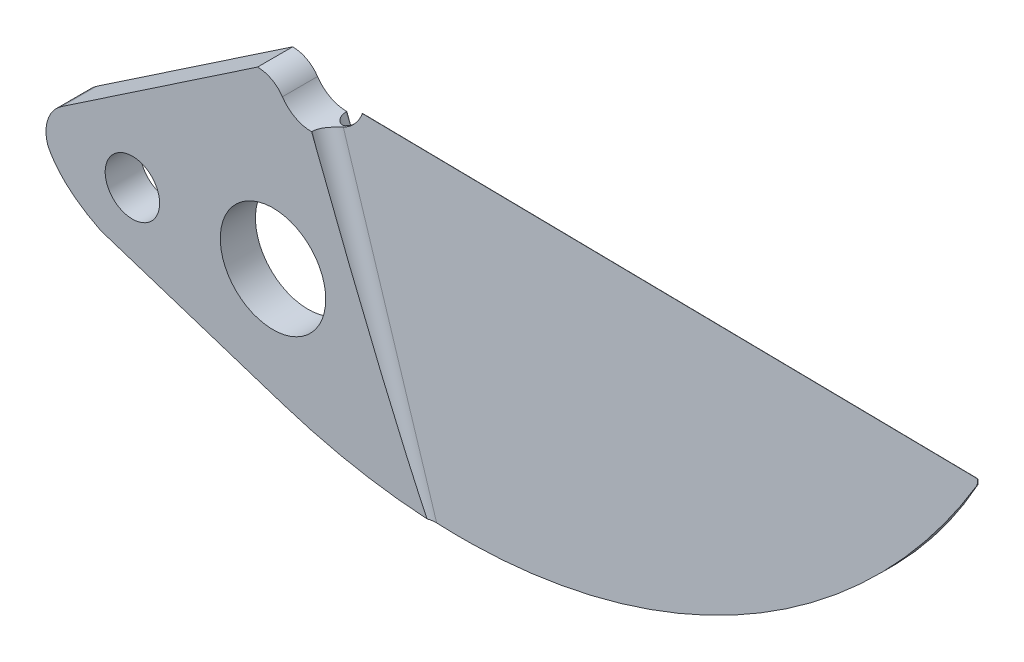
from build123d import *

# Parameters (mm, degrees)
SCHIZZO1_R                   = 3
ESTRUSIONE_ESTRUSIONE1_DEPTH = 1
ESTRUSIONE_ESTRUSIONE2_DEPTH = 0.95
SMUSSO1_SIZE                 = 18
SMUSSO1_SIZE_2               = 0.943340027
SMUSSO2_SIZE                 = 18
SMUSSO2_SIZE_2               = 0.943340027
RACCORDO1_R                  = 0.9
RACCORDO2_R                  = 0.9
TAGLIO_ESTRUSIONE1_DEPTH     = 10
RACCORDO3_R                  = 2
SCHIZZO3_R                   = 1.55
TAGLIO_ESTRUSIONE2_DEPTH     = 41.278810137


with BuildPart() as part:
    # Schizzo1 → Estrusione-Estrusione1 (new, symmetric)
    with BuildSketch(Plane.XY):
        with BuildLine():
            Line((-0.88, 9.5), (-19.130944839, 9.5))
            ThreePointArc((-19.130944839, 9.5), (-20.501263026, 8.610104965), (-20.245662077, 6.99630409))
            Line((-20.245662077, 6.99630409), (-15.960328698, 2.236959209))
            Line((-15.960328698, 2.236959209), (-14.839064722, 1.115695234))
            ThreePointArc((-14.839064722, 1.115695234), (-14.577677448, 0.895591951), (-14.282636649, 0.723197957))
            ThreePointArc((-14.282636649, 0.723197957), (-13.491665822, 0.254040408), (-12.8, -0.352047083))
            add(Edge.make_bspline(
                [(-9.8, -3.018897494), (-12.016366306, -1.919392636), (-12.8, -0.352047083)],
                knots=[0, 0, 0, 0.799118898, 0.799118898, 0.799118898], degree=2))
            Line((-9.8, -3.018897494), (0.594713885, -6.396344771))
            ThreePointArc((0.594713885, -6.396344771), (4.37641373, -7.379985604), (8.248348818, -7.906219091))
            Line((8.248348818, -7.906219091), (2.2, 7.850268275))
            ThreePointArc((2.2, 7.850268275), (1.255676497, 8.087244418), (0.535135135, 8.742015153))
            ThreePointArc((0.535135135, 8.742015153), (-0.077325022, 9.298570279), (-0.88, 9.5))
        make_face()
        Circle(SCHIZZO1_R, mode=Mode.SUBTRACT)
    extrude(amount=ESTRUSIONE_ESTRUSIONE1_DEPTH, both=True)

    # Schizzo1<4> → Estrusione-Estrusione2 (add, symmetric)
    with BuildSketch(Plane.XY):
        with BuildLine():
            ThreePointArc((4.091335816, 9.2), (3.361779551, 8.222303818), (2.2, 7.850268275))
            Line((2.2, 7.850268275), (8.248348818, -7.906219091))
            ThreePointArc((8.248348818, -7.906219091), (26.021901415, -4.20199667), (39.091335816, 8.4))
            Line((39.091335816, 8.4), (39.091335816, 8.7))
            Line((39.091335816, 8.7), (4.091335816, 9.2))
        make_face()
    extrude(amount=ESTRUSIONE_ESTRUSIONE2_DEPTH, both=True)

    # Smusso1
    # the kernel refuses this chamfer: 18, 0.943340027 mm, written as the material it takes off along each edge
    with BuildSketch(Plane(origin=(85.88418926, 8.031530665, 0.95), x_dir=(-0.01428422784103612, -0.9998959488725246, 0.002013023422382226), z_dir=(-0.99989797479951, 0.014284256782850195, 0))) as smusso1_piece_1_section:
        Polygon((SMUSSO1_SIZE * 0.999997973866, -SMUSSO1_SIZE * 0.00201302342238), (-SMUSSO1_SIZE_2 * 0.00201302342258, -SMUSSO1_SIZE_2 * 0.999997973967), (0, 0), align=None)
    smusso1_piece_1 = extrude(amount=128.598827208, mode=Mode.PRIVATE)
    smusso1_piece_1 = split(smusso1_piece_1, bisect_by=Plane(origin=(5.771356931, -1.453434613, 0.613202149), z_dir=(0.9335804264972009, 0.3583679495453028, 0)), keep=Keep.TOP, mode=Mode.PRIVATE)
    add(smusso1_piece_1, mode=Mode.SUBTRACT)

    # Smusso2
    # the kernel refuses this chamfer: 18, 0.943340027 mm, written as the material it takes off along each edge
    with BuildSketch(Plane(origin=(85.88418926, 8.031530665, -0.95), x_dir=(-0.01428422784103612, -0.9998959488725246, -0.002013023422382226), z_dir=(-0.99989797479951, 0.014284256782850195, 0))) as smusso2_piece_1_section:
        Polygon((SMUSSO2_SIZE * 0.999997973866, SMUSSO2_SIZE * 0.00201302342238), (-SMUSSO2_SIZE_2 * 0.00201302342258, SMUSSO2_SIZE_2 * 0.999997973967), (0, 0), align=None)
    smusso2_piece_1 = extrude(amount=128.598827208, mode=Mode.PRIVATE)
    smusso2_piece_1 = split(smusso2_piece_1, bisect_by=Plane(origin=(5.771356931, -1.453434613, -0.613202149), z_dir=(0.9335804264972009, 0.3583679495453028, 0)), keep=Keep.TOP, mode=Mode.PRIVATE)
    add(smusso2_piece_1, mode=Mode.SUBTRACT)

    # Raccordo1
    # the kernel refuses this fillet: 0.9 mm, written as the material it adds along each edge
    with BuildSketch(Plane(origin=(1.410141131, 9.907920978, -0.028429649), x_dir=(-0.017415293659521727, 0.04536839107084769, 0.9988185103603132), z_dir=(0.35794454152552274, -0.9324774108955555, 0.048596124964905896))) as raccordo1_piece_1_section:
        with BuildLine():
            CenterArc((RACCORDO1_R * 0.980734011967, -RACCORDO1_R), RACCORDO1_R, 90, 88.885438442)
            Line((-RACCORDO1_R * 0.0190767888902, -RACCORDO1_R * 0.980548457933), (0, 0))
            Line((0, 0), (RACCORDO1_R * 0.980734011967, 0))
        make_face()
    raccordo1_piece_1 = extrude(amount=21.310749772, mode=Mode.PRIVATE)
    raccordo1_piece_1 = raccordo1_piece_1 & Plane(origin=(10.715020451, 24.750756137, 0.600477284), x_dir=(-0.30901699437494573, -0.9510565162951542, 0), z_dir=(0, 0, 1)) * Cylinder(32.75, 47, mode=Mode.PRIVATE)
    raccordo1_piece_1 = split(raccordo1_piece_1, bisect_by=Plane(origin=(5.151176086, 0.789201867, 1), z_dir=(0, 0, -1)), keep=Keep.TOP, mode=Mode.PRIVATE)
    raccordo1_piece_1 = raccordo1_piece_1 - Plane(origin=(2.2, 9.850268275, 0.600477284), x_dir=(0, -1, 0), z_dir=(0, 0, 1)) * Cylinder(2, 47, mode=Mode.PRIVATE)
    add(raccordo1_piece_1)

    # Raccordo2
    # the kernel refuses this fillet: 0.9 mm, written as the material it adds along each edge
    with BuildSketch(Plane(origin=(1.410141131, 9.907920978, 0.028429649), x_dir=(-0.017415293659511128, 0.04536839107085176, -0.9988185103603133), z_dir=(0.35794454152552274, -0.9324774108955555, -0.048596124964905896))) as raccordo2_piece_1_section:
        with BuildLine():
            CenterArc((RACCORDO2_R * 0.980734011967, RACCORDO2_R), RACCORDO2_R, 181.114561558, 88.885438442)
            Line((-RACCORDO2_R * 0.0190767888902, RACCORDO2_R * 0.980548457933), (0, 0))
            Line((0, 0), (RACCORDO2_R * 0.980734011967, 0))
        make_face()
    raccordo2_piece_1 = extrude(amount=21.310749772, mode=Mode.PRIVATE)
    raccordo2_piece_1 = split(raccordo2_piece_1, bisect_by=Plane(origin=(5.151178194, 0.789195879, -1), z_dir=(0, 0, 1)), keep=Keep.TOP, mode=Mode.PRIVATE)
    raccordo2_piece_1 = raccordo2_piece_1 & Plane(origin=(10.715020451, 24.750756137, -0.600477223), x_dir=(-0.3090169943750401, -0.9510565162951234, 0), z_dir=(0, 0, 1)) * Cylinder(32.75, 47, mode=Mode.PRIVATE)
    raccordo2_piece_1 = raccordo2_piece_1 - Plane(origin=(2.2, 9.850268275, -0.600477223), x_dir=(0, -1, 0), z_dir=(0, 0, 1)) * Cylinder(2, 47, mode=Mode.PRIVATE)
    add(raccordo2_piece_1)

    # Schizzo2 → Taglio-Estrusione1 (cut)
    with BuildSketch(Plane.XY.offset(1)):
        Polygon((-0.88, 9.5), (-30.88, -10.735255505), (-30.88, 9.5), align=None)
    extrude(amount=-TAGLIO_ESTRUSIONE1_DEPTH, mode=Mode.SUBTRACT)

    # Raccordo3
    # the kernel refuses this fillet: 2 mm, written as the material it takes off along each edge
    with BuildSketch(Plane(origin=(-14.059482684, 0.610326682, -7.107620692), x_dir=(0.7945891525397701, -0.6071474933375991, 0), z_dir=(0, 0, 1))) as raccordo3_piece_1:
        with BuildLine():
            CenterArc((2.675251835, 1.676756542), RACCORDO3_R, 161.383532721, 75.585730468)
            Line((0.779898436, 2.315219927), (0.741991368, 2.327989195))
            Line((0.741991368, 2.327989195), (-0.037907068, 0.012769268))
            Line((-0.037907068, 0.012769268), (0.006340296, -0.039494312))
            ThreePointArc((0.006340296, -0.039494312), (0.792537049, 0.023211061), (1.563270543, -0.033535131))
            Line((1.563270543, -0.033535131), (1.585074098, 0))
        make_face()
    extrude(amount=14.215241383, mode=Mode.SUBTRACT)

    # Schizzo3 → Taglio-Estrusione2 (cut, through all)
    with BuildSketch(Plane(origin=(0, 0, -1), x_dir=(-1, 0, 0), z_dir=(0, 0, -1))):
        with Locations((8, 0)):
            Circle(SCHIZZO3_R)
    extrude(amount=-TAGLIO_ESTRUSIONE2_DEPTH, mode=Mode.SUBTRACT)


solid = part.part
